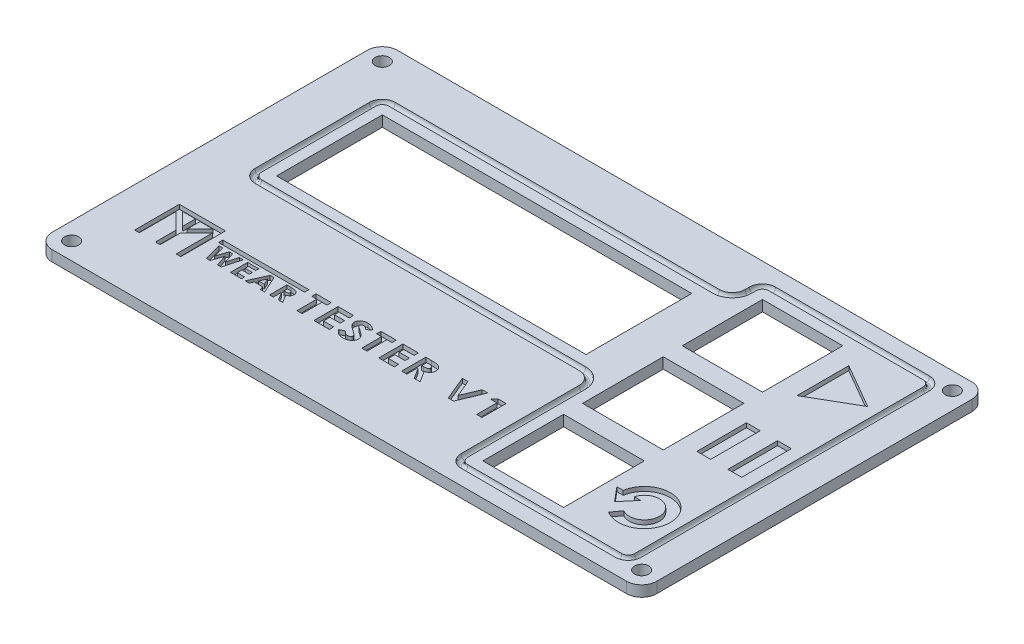
from build123d import *

# Parameters (mm, degrees)
SKETCH1_W           = 140.1
SKETCH1_H           = 80
SKETCH1_R           = 1.65
SKETCH1_W_2         = 71.7
SKETCH1_H_2         = 24.5
SKETCH1_W_3         = 18.6
SKETCH1_H_3         = 18.6
SKETCH1_W_4         = 18.7
SKETCH1_H_4         = 18.7
BOSS_EXTRUDE1_DEPTH = 2.5
FILLET1_R           = 3.5
SKETCH2_W           = 3.2
SKETCH2_H           = 11.5
SKETCH2_W_2         = 19.936371481
SKETCH2_H_2         = 1
CUT_EXTRUDE2_DEPTH  = 1
FILLET2_SIZE        = 1
FILLET2_SIZE_2      = 0.6
FILLET3_SIZE        = 0.6
FILLET3_SIZE_2      = 1


with BuildPart() as part:
    # Sketch1 → Boss-Extrude1 (new body)
    with BuildSketch(Plane(origin=(0, 0, 0), x_dir=(1, 0, 0), z_dir=(0, 1, 0))):
        Rectangle(SKETCH1_W, SKETCH1_H)
        with Locations(Location((-66.05, 36, 0), (0, 0, 270))):
            Circle(SKETCH1_R, mode=Mode.SUBTRACT)
        with Locations(Location((-66.05, -36, 0), (0, 0, 270))):
            Circle(SKETCH1_R, mode=Mode.SUBTRACT)
        with Locations(Location((66.05, -36, 0), (0, 0, 270))):
            Circle(SKETCH1_R, mode=Mode.SUBTRACT)
        with Locations(Location((66.05, 36, 0), (0, 0, 270))):
            Circle(SKETCH1_R, mode=Mode.SUBTRACT)
        with Locations((-19.5, 13.05)):
            Rectangle(SKETCH1_W_2, SKETCH1_H_2, mode=Mode.SUBTRACT)
        with Locations((35.05, 23)):
            Rectangle(SKETCH1_W_3, SKETCH1_H_3, mode=Mode.SUBTRACT)
        with Locations((35.1, -0.05)):
            Rectangle(SKETCH1_W_4, SKETCH1_H_4, mode=Mode.SUBTRACT)
        with Locations((35.1, -23.15)):
            Rectangle(SKETCH1_W_4, SKETCH1_H_4, mode=Mode.SUBTRACT)
    extrude(amount=BOSS_EXTRUDE1_DEPTH)

    # Fillet1
    fillet1_edges = [part.edges().sort_by_distance(p)[0] for p in [
        (-70.05, 1.25, 40),
        (-70.05, 1.25, -40),
        (70.05, 1.25, -40),
        (70.05, 1.25, 40),
    ]]
    fillet(fillet1_edges, radius=FILLET1_R)

    # Sketch2 → Cut-Extrude2 (cut)
    # profile 1 of 19: a face of its own
    with BuildSketch(Plane(origin=(0, 2.5, 0), x_dir=(1, 0, 0), z_dir=(0, 1, 0))):
        Polygon((-50.240034191, -26.517723152), (-51.318411587, -26.517723152), (-51.318411587, -18.049182696), (-55.044160754, -21.760714839), (-55.044160754, -26.517723152), (-56.124160754, -26.517723152), (-56.124160754, -21.760714839), (-59.849909921, -18.049182696), (-59.849909921, -26.517723152), (-60.928287316, -26.517723152), (-60.928287316, -16.167723152), (-50.240034191, -16.167723152), align=None)
        Polygon((-56.124160754, -17.247723152), (-56.124160754, -20.236275502), (-59.124160754, -17.247723152), align=None, mode=Mode.SUBTRACT)
        Polygon((-52.044160754, -17.247723152), (-55.044160754, -17.247723152), (-55.044160754, -20.236275502), align=None, mode=Mode.SUBTRACT)
    # profile 2 of 19: a face of its own
    with BuildSketch(Plane(origin=(0, 2.5, 0), x_dir=(1, 0, 0), z_dir=(0, 1, 0))):
        with BuildLine():
            Line((-59.35, -0.2), (-59.35, 26.3))
            ThreePointArc((-59.35, 26.3), (-58.471320344, 28.421320344), (-56.35, 29.3))
            Line((-56.35, 29.3), (18.75, 29.3))
            ThreePointArc((18.75, 29.3), (20.871320344, 30.178679656), (21.75, 32.3))
            Line((21.75, 32.3), (21.75, 33.3))
            ThreePointArc((21.75, 33.3), (22.628679656, 35.421320344), (24.75, 36.3))
            Line((24.75, 36.3), (60.435027532, 36.3))
            ThreePointArc((60.435027532, 36.3), (62.556347876, 35.421320344), (63.435027532, 33.3))
            Line((63.435027532, 33.3), (63.435027532, -33.5))
            ThreePointArc((63.435027532, -33.5), (62.556347876, -35.621320344), (60.435027532, -36.5))
            Line((60.435027532, -36.5), (24.75, -36.5))
            ThreePointArc((24.75, -36.5), (22.628679656, -35.621320344), (21.75, -33.5))
            Line((21.75, -33.5), (21.75, -6.2))
            ThreePointArc((21.75, -6.2), (20.871320344, -4.078679656), (18.75, -3.2))
            Line((18.75, -3.2), (-56.35, -3.2))
            ThreePointArc((-56.35, -3.2), (-58.471320344, -2.321320344), (-59.35, -0.2))
        make_face()
        with BuildLine():
            Line((-57.85, -0.2), (-57.85, 26.3))
            ThreePointArc((-57.85, 26.3), (-57.410660172, 27.360660172), (-56.35, 27.8))
            Line((-56.35, 27.8), (18.75, 27.8))
            ThreePointArc((18.75, 27.8), (21.931980515, 29.118019485), (23.25, 32.3))
            Line((23.25, 32.3), (23.25, 33.3))
            ThreePointArc((23.25, 33.3), (23.689339828, 34.360660172), (24.75, 34.8))
            Line((24.75, 34.8), (60.435027532, 34.8))
            ThreePointArc((60.435027532, 34.8), (61.495687704, 34.360660172), (61.935027532, 33.3))
            Line((61.935027532, 33.3), (61.935027532, -33.5))
            ThreePointArc((61.935027532, -33.5), (61.495687704, -34.560660172), (60.435027532, -35))
            Line((60.435027532, -35), (24.75, -35))
            ThreePointArc((24.75, -35), (23.689339828, -34.560660172), (23.25, -33.5))
            Line((23.25, -33.5), (23.25, -6.2))
            ThreePointArc((23.25, -6.2), (21.931980515, -3.018019485), (18.75, -1.7))
            Line((18.75, -1.7), (-56.35, -1.7))
            ThreePointArc((-56.35, -1.7), (-57.410660172, -1.260660172), (-57.85, -0.2))
        make_face(mode=Mode.SUBTRACT)
    # profile 3 of 19: a face of its own
    with BuildSketch(Plane(origin=(0, 2.5, 0), x_dir=(1, 0, 0), z_dir=(0, 1, 0))):
        Polygon((49.042722687, 17), (59.435027532, 23), (49.042722687, 29), align=None)
    # profile 4 of 19: a face of its own
    with BuildSketch(Plane(origin=(0, 2.5, 0), x_dir=(1, 0, 0), z_dir=(0, 1, 0))):
        with Locations((57.43602259, -0.05)):
            Rectangle(SKETCH2_W, SKETCH2_H)
    # profile 5 of 19: a face of its own
    with BuildSketch(Plane(origin=(0, 2.5, 0), x_dir=(1, 0, 0), z_dir=(0, 1, 0))):
        with Locations((50.23602259, -0.05)):
            Rectangle(SKETCH2_W, SKETCH2_H)
    # profile 6 of 19: a face of its own
    with BuildSketch(Plane(origin=(0, 2.5, 0), x_dir=(1, 0, 0), z_dir=(0, 1, 0))):
        with BuildLine():
            ThreePointArc((52.084986216, -26.180490326), (57.088225295, -21.856486349), (50.481920624, -22.15))
            Line((50.481920624, -22.15), (51.950931715, -22.15))
            Line((51.950931715, -22.15), (49.200931715, -25.42732238))
            Line((49.200931715, -25.42732238), (46.450931715, -22.15))
            Line((46.450931715, -22.15), (47.919942807, -22.15))
            ThreePointArc((47.919942807, -22.15), (59.320223003, -20.716166433), (50.608376185, -28.207894689))
            Line((50.608376185, -28.207894689), (52.084986216, -26.180490326))
        make_face()
    # profile 7 of 19: a face of its own
    with BuildSketch(Plane(origin=(0, 2.5, 0), x_dir=(1, 0, 0), z_dir=(0, 1, 0))):
        Polygon((14.285191156, -19.233333333), (15.025575772, -18.3), (16.941601413, -18.3), (16.941601413, -23.9), (15.721088592, -23.9), (15.721088592, -19.233333333), align=None)
    # profile 8 of 19: a face of its own
    with BuildSketch(Plane(origin=(0, 2.5, 0), x_dir=(1, 0, 0), z_dir=(0, 1, 0))):
        Polygon((9.123588592, -23.9), (6.796986028, -18.3), (8.087050131, -18.3), (9.740575772, -22.277884615), (11.394101413, -18.3), (12.684165515, -18.3), (10.356441156, -23.9), align=None)
    # profile 9 of 19: a face of its own
    with BuildSketch(Plane(origin=(0, 2.5, 0), x_dir=(1, 0, 0), z_dir=(0, 1, 0))):
        with BuildLine():
            add(Edge.make_bspline(
                [(2.266729618, -19.890705128), (2.267144332, -19.977390659), (2.258340694, -20.10544927), (2.225158053, -20.27053108), (2.189709002, -20.386590015), (2.146746563, -20.49790918), (2.09189184, -20.603117988), (2.028337351, -20.70283251), (1.954292015, -20.796718222), (1.871659061, -20.885691497), (1.777194818, -20.967511669), (1.674387919, -21.045409858), (1.559883011, -21.115687884), (1.436752447, -21.181828691), (1.25482109, -21.265056215), (1.109430364, -21.314458371), (1.009197567, -21.344551282)],
                knots=[0, 0, 0, 0, 0.124685843, 0.18396903, 0.241824688, 0.299056927, 0.3553488, 0.412195564, 0.46889965, 0.527121683, 0.586575429, 0.64843074, 0.712457877, 0.779597179, 0.84939634, 1, 1, 1, 1], degree=3))
            Line((1.009197567, -21.344551282), (2.589806541, -23.9))
            Line((2.589806541, -23.9), (1.213364233, -23.9))
            Line((1.213364233, -23.9), (-0.296571664, -21.458974359))
            Line((-0.296571664, -21.458974359), (-0.46147551, -21.458974359))
            Line((-0.46147551, -21.458974359), (-0.46147551, -23.9))
            Line((-0.46147551, -23.9), (-1.681988331, -23.9))
            Line((-1.681988331, -23.9), (-1.681988331, -18.3))
            Line((-1.681988331, -18.3), (-0.340321664, -18.3))
            add(Edge.make_bspline(
                [(-0.340321664, -18.3), (-0.169749492, -18.299198568), (0.076449583, -18.30449338), (0.391329799, -18.320776826), (0.597904391, -18.338396725), (0.784255643, -18.361796489), (0.950825187, -18.389718018), (1.098056552, -18.421110225), (1.227559269, -18.460181554), (1.344133513, -18.504511973), (1.452575611, -18.555670423), (1.555722508, -18.612291044), (1.652643902, -18.676780442), (1.743812263, -18.747591569), (1.829292245, -18.825247788), (1.90915758, -18.909632872), (1.982945412, -19.000416268), (2.05021207, -19.095872103), (2.107914461, -19.197131658), (2.156990963, -19.302180588), (2.198159354, -19.411463339), (2.227743995, -19.52559247), (2.258560394, -19.684731823), (2.266729855, -19.807823008), (2.266729618, -19.890705128)],
                knots=[0, 0, 0, 0, 0.147269181, 0.212586271, 0.272219192, 0.326243378, 0.374705614, 0.418026054, 0.456126503, 0.491384828, 0.52561704, 0.559580208, 0.592892562, 0.626024487, 0.659167423, 0.692512619, 0.726247885, 0.760104993, 0.79322433, 0.826734811, 0.860140914, 0.89389626, 0.928407503, 1, 1, 1, 1], degree=3))
        make_face()
        with BuildLine():
            add(Edge.make_bspline(
                [(1.046216797, -19.87724359), (1.04775643, -19.81869546), (1.031982403, -19.732399747), (0.983202001, -19.626849), (0.930775933, -19.556962856), (0.86767476, -19.49336031), (0.7931635, -19.439727123), (0.709009563, -19.395508715), (0.630840981, -19.367363918), (0.5593481, -19.349827002), (0.494965121, -19.337658388), (0.420009145, -19.327968024), (0.335513434, -19.318882865), (0.240470903, -19.312322001), (0.093507814, -19.306191139), (-0.02211035, -19.305877661), (-0.102501151, -19.305128205)],
                knots=[0, 0, 0, 0, 0.121157123, 0.179568666, 0.240197836, 0.301751564, 0.365180649, 0.430194707, 0.498789664, 0.537245038, 0.583128135, 0.634900267, 0.694296343, 0.759750269, 0.832876305, 1, 1, 1, 1], degree=3))
            Line((-0.102501151, -19.305128205), (-0.46147551, -19.305128205))
            Line((-0.46147551, -19.305128205), (-0.46147551, -20.453846154))
            Line((-0.46147551, -20.453846154), (-0.050898587, -20.453846154))
            add(Edge.make_bspline(
                [(-0.050898587, -20.453846154), (0.04517916, -20.452545133), (0.183932255, -20.451962897), (0.359948434, -20.436012399), (0.474031244, -20.421275801), (0.576031, -20.404793419), (0.665286522, -20.380380753), (0.743156176, -20.354483217), (0.809480202, -20.322755521), (0.865855873, -20.285946658), (0.914721254, -20.244551063), (0.955314561, -20.196464221), (0.989894663, -20.143847785), (1.013769982, -20.08397456), (1.040803248, -19.996363165), (1.046492365, -19.925297103), (1.046216797, -19.87724359)],
                knots=[0, 0, 0, 0, 0.204850554, 0.295232061, 0.376364878, 0.449978777, 0.515105679, 0.573310074, 0.624622973, 0.671249972, 0.716445993, 0.760518514, 0.804942502, 0.849927358, 0.897317291, 1, 1, 1, 1], degree=3))
        make_face(mode=Mode.SUBTRACT)
    # profile 10 of 19: a face of its own
    with BuildSketch(Plane(origin=(0, 2.5, 0), x_dir=(1, 0, 0), z_dir=(0, 1, 0))):
        Polygon((-6.980449869, -23.9), (-6.980449869, -18.3), (-3.390706279, -18.3), (-3.390706279, -19.305128205), (-5.759937049, -19.305128205), (-5.759937049, -20.382051282), (-3.390706279, -20.382051282), (-3.390706279, -21.387179487), (-5.759937049, -21.387179487), (-5.759937049, -22.894871795), (-3.390706279, -22.894871795), (-3.390706279, -23.9), align=None)
    # profile 11 of 19: a face of its own
    with BuildSketch(Plane(origin=(0, 2.5, 0), x_dir=(1, 0, 0), z_dir=(0, 1, 0))):
        Polygon((-12.063526792, -19.305128205), (-12.063526792, -18.3), (-8.545578074, -18.3), (-8.545578074, -19.305128205), (-9.694296023, -19.305128205), (-9.694296023, -23.9), (-10.914808844, -23.9), (-10.914808844, -19.305128205), align=None)
    # profile 12 of 19: a face of its own
    with BuildSketch(Plane(origin=(0, 2.5, 0), x_dir=(1, 0, 0), z_dir=(0, 1, 0))):
        with BuildLine():
            add(Edge.make_bspline(
                [(-15.18346269, -18.156410256), (-15.021264712, -18.156696864), (-14.77902978, -18.1803204), (-14.465844465, -18.260213372), (-14.276042312, -18.330871228), (-14.125279306, -18.400685874), (-14.009584224, -18.463783948), (-13.89201863, -18.537547421), (-13.770314969, -18.61859778), (-13.648718712, -18.712662758), (-13.477814334, -18.852560962), (-13.352165983, -18.966726984), (-13.269680638, -19.048237179)],
                knots=[0, 0, 0, 0, 0.224009204, 0.33438332, 0.445685447, 0.503228736, 0.563788081, 0.627576777, 0.694912236, 0.765680889, 0.839822751, 1, 1, 1, 1], degree=3))
            Line((-13.269680638, -19.048237179), (-14.208622946, -19.735897436))
            add(Edge.make_bspline(
                [(-14.208622946, -19.735897436), (-14.28521643, -19.64656079), (-14.404349645, -19.522902548), (-14.577951076, -19.385967713), (-14.703945426, -19.304365653), (-14.830477802, -19.240457496), (-14.998563549, -19.180537752), (-15.12958021, -19.16148255), (-15.215994741, -19.161538462)],
                knots=[0, 0, 0, 0, 0.295303603, 0.428877079, 0.553739135, 0.671167669, 0.783579981, 1, 1, 1, 1], degree=3))
            add(Edge.make_bspline(
                [(-15.215994741, -19.161538462), (-15.292080893, -19.161300011), (-15.403752676, -19.1723057), (-15.538925272, -19.222286654), (-15.623811895, -19.271119197), (-15.692462899, -19.328469556), (-15.760522048, -19.407725305), (-15.781876581, -19.481196624), (-15.782501151, -19.528365385)],
                knots=[0, 0, 0, 0, 0.308988589, 0.447952035, 0.580944808, 0.70349073, 0.808979184, 1, 1, 1, 1], degree=3))
            add(Edge.make_bspline(
                [(-15.782501151, -19.528365385), (-15.784213379, -19.576259806), (-15.758431899, -19.673891345), (-15.704671734, -19.758950388), (-15.668078074, -19.796474359)],
                knots=[0, 0, 0, 0, 0.475944074, 1, 1, 1, 1], degree=3))
            add(Edge.make_bspline(
                [(-15.668078074, -19.796474359), (-15.632338804, -19.83572635), (-15.562869687, -19.894982782), (-15.457543968, -19.982200478), (-15.349162231, -20.065885237), (-15.222695638, -20.162892508), (-15.013245214, -20.314423124), (-14.848226659, -20.436718093), (-14.729135767, -20.518910256)],
                knots=[0, 0, 0, 0, 0.133977227, 0.230759984, 0.346009525, 0.480349956, 0.633995626, 1, 1, 1, 1], degree=3))
            add(Edge.make_bspline(
                [(-14.729135767, -20.518910256), (-14.619520432, -20.596760196), (-14.46222691, -20.70516031), (-14.267270859, -20.846161794), (-14.145847118, -20.93100108), (-14.044975245, -21.007446548), (-13.943717562, -21.081872045), (-13.878181811, -21.133993449), (-13.840674228, -21.165064103)],
                knots=[0, 0, 0, 0, 0.367088787, 0.521492782, 0.656907828, 0.771457166, 0.867016653, 1, 1, 1, 1], degree=3))
            add(Edge.make_bspline(
                [(-13.840674228, -21.165064103), (-13.722853561, -21.264876195), (-13.561168924, -21.416164971), (-13.38466809, -21.634769316), (-13.28693275, -21.789356731), (-13.21548261, -21.946432267), (-13.143889861, -22.16277035), (-13.126840143, -22.334715791), (-13.126090895, -22.449519231)],
                knots=[0, 0, 0, 0, 0.304366804, 0.434332212, 0.552441623, 0.663491149, 0.773416579, 1, 1, 1, 1], degree=3))
            add(Edge.make_bspline(
                [(-13.126090895, -22.449519231), (-13.127182424, -22.560338293), (-13.141053443, -22.726120624), (-13.202883659, -22.935098033), (-13.263309388, -23.083449405), (-13.344395477, -23.222621556), (-13.440622934, -23.355988322), (-13.556945606, -23.479827575), (-13.68834541, -23.595606938), (-13.834074509, -23.700837492), (-13.991620656, -23.793343173), (-14.160237335, -23.870372616), (-14.339312219, -23.933771608), (-14.5289709, -23.982520315), (-14.802111841, -24.031800748), (-15.014493884, -24.043740467), (-15.158783203, -24.043589744)],
                knots=[0, 0, 0, 0, 0.115370381, 0.171176354, 0.225851727, 0.281350033, 0.338062346, 0.396328134, 0.45742003, 0.519729533, 0.58274682, 0.646875847, 0.711984232, 0.779812749, 0.850056995, 1, 1, 1, 1], degree=3))
            add(Edge.make_bspline(
                [(-15.158783203, -24.043589744), (-15.273026102, -24.043587144), (-15.442098494, -24.035271477), (-15.662530734, -24.005035473), (-15.819911957, -23.973695959), (-15.971669608, -23.933263746), (-16.117624423, -23.884203515), (-16.257547864, -23.825147518), (-16.392620748, -23.758252436), (-16.522061772, -23.680118991), (-16.646826978, -23.592787592), (-16.765978333, -23.494411207), (-16.881063452, -23.386496458), (-16.990291591, -23.267237375), (-17.134256595, -23.09346693), (-17.230264176, -22.950771992), (-17.290193459, -22.851121795)],
                knots=[0, 0, 0, 0, 0.133395033, 0.197301531, 0.25963615, 0.320636965, 0.38055795, 0.43926413, 0.497840285, 0.556393655, 0.615625126, 0.675496782, 0.736652083, 0.799680074, 0.864190716, 1, 1, 1, 1], degree=3))
            Line((-17.290193459, -22.851121795), (-16.224488331, -22.320512821))
            add(Edge.make_bspline(
                [(-16.224488331, -22.320512821), (-16.150646032, -22.432325361), (-16.029977842, -22.585461915), (-15.8480737, -22.758199416), (-15.711491534, -22.860779645), (-15.56947795, -22.939776038), (-15.374844941, -23.016120955), (-15.219999677, -23.038394357), (-15.117276792, -23.038461538)],
                knots=[0, 0, 0, 0, 0.292060695, 0.42295247, 0.545866055, 0.663349338, 0.776115142, 1, 1, 1, 1], degree=3))
            add(Edge.make_bspline(
                [(-15.117276792, -23.038461538), (-15.015866586, -23.039028908), (-14.867602944, -23.020508185), (-14.685089164, -22.953000813), (-14.569378912, -22.882427848), (-14.471567816, -22.801543336), (-14.377716632, -22.683360403), (-14.345024, -22.577556504), (-14.346603715, -22.507852564)],
                knots=[0, 0, 0, 0, 0.2954704, 0.430684796, 0.564139584, 0.688618973, 0.798927781, 1, 1, 1, 1], degree=3))
            add(Edge.make_bspline(
                [(-14.346603715, -22.507852564), (-14.345007698, -22.441588145), (-14.372006412, -22.341359242), (-14.441610817, -22.216847756), (-14.503640899, -22.138131483), (-14.567038648, -22.072001539), (-14.629115094, -22.015458784), (-14.702966271, -21.951140192), (-14.790991284, -21.882239685), (-14.890831142, -21.805952254), (-15.047797295, -21.689274146), (-15.175120222, -21.603118884), (-15.263110126, -21.541987179)],
                knots=[0, 0, 0, 0, 0.142845548, 0.221998529, 0.309697071, 0.360419396, 0.421544443, 0.492611602, 0.573810517, 0.665086112, 0.766465276, 1, 1, 1, 1], degree=3))
            add(Edge.make_bspline(
                [(-15.263110126, -21.541987179), (-15.431607509, -21.427057665), (-15.671918732, -21.259010396), (-15.971641243, -21.035524271), (-16.161259618, -20.885445045), (-16.326507713, -20.746158375), (-16.46868981, -20.618956783), (-16.585745314, -20.501504654), (-16.680811629, -20.392531286), (-16.756934902, -20.287993281), (-16.823157383, -20.186690949), (-16.877827056, -20.084766492), (-16.92320657, -19.982795461), (-16.959616562, -19.881406361), (-16.991766234, -19.746540664), (-17.004545894, -19.644568228), (-17.003013972, -19.576602564)],
                knots=[0, 0, 0, 0, 0.224706294, 0.32299845, 0.411847771, 0.491072557, 0.561070729, 0.621952114, 0.673650235, 0.720202811, 0.764310708, 0.806887658, 0.847460379, 0.88719842, 0.925365868, 1, 1, 1, 1], degree=3))
            add(Edge.make_bspline(
                [(-17.003013972, -19.576602564), (-17.003542791, -19.48193338), (-16.987727335, -19.340324338), (-16.931526742, -19.160452522), (-16.873829836, -19.031739225), (-16.800164377, -18.907885091), (-16.708565604, -18.790432191), (-16.60133605, -18.677881848), (-16.479556786, -18.572123211), (-16.345733394, -18.474971245), (-16.202242512, -18.389799063), (-16.05079142, -18.317737047), (-15.892206342, -18.257887737), (-15.725803005, -18.212157899), (-15.489873886, -18.167725204), (-15.307142561, -18.157277807), (-15.18346269, -18.156410256)],
                knots=[0, 0, 0, 0, 0.110921546, 0.165526908, 0.220249932, 0.275858717, 0.333966338, 0.394404589, 0.457760192, 0.522706535, 0.587934591, 0.653003504, 0.719006979, 0.786299609, 0.854964891, 1, 1, 1, 1], degree=3))
        make_face()
    # profile 13 of 19: a face of its own
    with BuildSketch(Plane(origin=(0, 2.5, 0), x_dir=(1, 0, 0), z_dir=(0, 1, 0))):
        Polygon((-22.014296023, -23.9), (-22.014296023, -18.3), (-18.424552433, -18.3), (-18.424552433, -19.305128205), (-20.793783203, -19.305128205), (-20.793783203, -20.382051282), (-18.424552433, -20.382051282), (-18.424552433, -21.387179487), (-20.793783203, -21.387179487), (-20.793783203, -22.894871795), (-18.424552433, -22.894871795), (-18.424552433, -23.9), align=None)
    # profile 14 of 19: a face of its own
    with BuildSketch(Plane(origin=(0, 2.5, 0), x_dir=(1, 0, 0), z_dir=(0, 1, 0))):
        Polygon((-27.097372946, -19.305128205), (-27.097372946, -18.3), (-23.579424228, -18.3), (-23.579424228, -19.305128205), (-24.728142177, -19.305128205), (-24.728142177, -23.9), (-25.948654997, -23.9), (-25.948654997, -19.305128205), align=None)
    # profile 15 of 19: a face of its own
    with BuildSketch(Plane(origin=(0, 2.5, 0), x_dir=(1, 0, 0), z_dir=(0, 1, 0))):
        with BuildLine():
            add(Edge.make_bspline(
                [(-29.463431339, -21.036217949), (-29.463135115, -21.098136185), (-29.469423427, -21.189606621), (-29.493125314, -21.3075222), (-29.518446065, -21.390421439), (-29.549133521, -21.469935128), (-29.588315466, -21.545084277), (-29.633711529, -21.616308936), (-29.686601056, -21.683370158), (-29.745624594, -21.746922498), (-29.813099053, -21.805365478), (-29.886532552, -21.861007041), (-29.968321772, -21.911205631), (-30.056272175, -21.958449065), (-30.186223145, -22.017897297), (-30.290073663, -22.05318455), (-30.361668518, -22.074679487)],
                knots=[0, 0, 0, 0, 0.124685843, 0.18396903, 0.241824688, 0.299056927, 0.3553488, 0.412195564, 0.46889965, 0.527121683, 0.586575429, 0.64843074, 0.712457877, 0.779597179, 0.84939634, 1, 1, 1, 1], degree=3))
            Line((-30.361668518, -22.074679487), (-29.232662108, -23.9))
            Line((-29.232662108, -23.9), (-30.215835185, -23.9))
            Line((-30.215835185, -23.9), (-31.294360826, -22.156410256))
            Line((-31.294360826, -22.156410256), (-31.412149288, -22.156410256))
            Line((-31.412149288, -22.156410256), (-31.412149288, -23.9))
            Line((-31.412149288, -23.9), (-32.283944159, -23.9))
            Line((-32.283944159, -23.9), (-32.283944159, -19.9))
            Line((-32.283944159, -19.9), (-31.325610826, -19.9))
            add(Edge.make_bspline(
                [(-31.325610826, -19.9), (-31.20377356, -19.899427549), (-31.027917078, -19.903209557), (-30.803002638, -19.91484059), (-30.655449358, -19.927426232), (-30.522341321, -19.94414035), (-30.403363075, -19.964084299), (-30.298197814, -19.986507303), (-30.205695874, -20.014415396), (-30.122428557, -20.046079981), (-30.044969915, -20.082621731), (-29.97129356, -20.123065032), (-29.902063993, -20.169128887), (-29.836943735, -20.219708264), (-29.775886605, -20.275176992), (-29.718839937, -20.335452052), (-29.666134343, -20.400297335), (-29.61808673, -20.468480073), (-29.576870736, -20.540808327), (-29.541816092, -20.615843277), (-29.512410099, -20.693902385), (-29.491278212, -20.775423193), (-29.469266499, -20.889094159), (-29.46343117, -20.977016435), (-29.463431339, -21.036217949)],
                knots=[0, 0, 0, 0, 0.147269181, 0.212586271, 0.272219192, 0.326243378, 0.374705614, 0.418026054, 0.456126503, 0.491384828, 0.52561704, 0.559580208, 0.592892562, 0.626024487, 0.659167423, 0.692512619, 0.726247885, 0.760104993, 0.79322433, 0.826734811, 0.860140914, 0.89389626, 0.928407503, 1, 1, 1, 1], degree=3))
        make_face()
        with BuildLine():
            add(Edge.make_bspline(
                [(-30.335226211, -21.026602564), (-30.334126474, -20.984782472), (-30.345393635, -20.923142676), (-30.38023678, -20.847749286), (-30.417683971, -20.797830611), (-30.462756238, -20.752400221), (-30.515978566, -20.714090802), (-30.576088521, -20.682506225), (-30.631923223, -20.662402798), (-30.682989566, -20.64987643), (-30.728977408, -20.641184563), (-30.782517391, -20.634262875), (-30.84287147, -20.627773475), (-30.910758992, -20.623087143), (-31.015732628, -20.618707957), (-31.09831703, -20.618484043), (-31.155739031, -20.617948718)],
                knots=[0, 0, 0, 0, 0.121157123, 0.179568666, 0.240197836, 0.301751564, 0.365180649, 0.430194707, 0.498789664, 0.537245038, 0.583128135, 0.634900267, 0.694296343, 0.759750269, 0.832876305, 1, 1, 1, 1], degree=3))
            Line((-31.155739031, -20.617948718), (-31.412149288, -20.617948718))
            Line((-31.412149288, -20.617948718), (-31.412149288, -21.438461538))
            Line((-31.412149288, -21.438461538), (-31.118880057, -21.438461538))
            add(Edge.make_bspline(
                [(-31.118880057, -21.438461538), (-31.050253095, -21.437532238), (-30.951143741, -21.437116355), (-30.825417899, -21.425723142), (-30.743930178, -21.415197001), (-30.671073209, -21.403423871), (-30.607319265, -21.385986252), (-30.551698083, -21.367488012), (-30.504323779, -21.344825372), (-30.464055443, -21.318533327), (-30.429151599, -21.288965045), (-30.40015638, -21.2546173), (-30.375456307, -21.217034132), (-30.358402508, -21.174267543), (-30.339093032, -21.111687975), (-30.335029377, -21.060926502), (-30.335226211, -21.026602564)],
                knots=[0, 0, 0, 0, 0.204850554, 0.295232061, 0.376364878, 0.449978777, 0.515105679, 0.573310074, 0.624622973, 0.671249972, 0.716445993, 0.760518514, 0.804942502, 0.849927358, 0.897317291, 1, 1, 1, 1], degree=3))
        make_face(mode=Mode.SUBTRACT)
    # profile 16 of 19: a face of its own
    with BuildSketch(Plane(origin=(0, 2.5, 0), x_dir=(1, 0, 0), z_dir=(0, 1, 0))):
        Polygon((-41.340354416, -23.9), (-41.340354416, -19.9), (-38.776251852, -19.9), (-38.776251852, -20.617948718), (-40.468559544, -20.617948718), (-40.468559544, -21.387179487), (-38.776251852, -21.387179487), (-38.776251852, -22.105128205), (-40.468559544, -22.105128205), (-40.468559544, -23.182051282), (-38.776251852, -23.182051282), (-38.776251852, -23.9), align=None)
    # profile 17 of 19: a face of its own
    with BuildSketch(Plane(origin=(0, 2.5, 0), x_dir=(1, 0, 0), z_dir=(0, 1, 0))):
        Polygon((-37.940354416, -23.9), (-36.131860826, -19.9), (-35.237630057, -19.9), (-33.427533903, -23.9), (-34.359424929, -23.9), (-34.72320698, -23.079487179), (-36.643880057, -23.079487179), (-37.007662108, -23.9), align=None)
        Polygon((-35.041315954, -22.361538462), (-35.683944159, -20.972916667), (-36.326572365, -22.361538462), align=None, mode=Mode.SUBTRACT)
    # profile 18 of 19: a face of its own
    with BuildSketch(Plane(origin=(0, 2.5, 0), x_dir=(1, 0, 0), z_dir=(0, 1, 0))):
        with Locations((-38.733707137, -18.8)):
            Rectangle(SKETCH2_W_2, SKETCH2_H_2)
    # profile 19 of 19: a face of its own
    with BuildSketch(Plane(origin=(0, 2.5, 0), x_dir=(1, 0, 0), z_dir=(0, 1, 0))):
        Polygon((-46.935867236, -23.9), (-48.022405698, -19.9), (-47.125771083, -19.9), (-46.432662108, -22.453685897), (-45.579296724, -19.9), (-44.821283903, -19.9), (-43.971123647, -22.453685897), (-43.279617236, -19.9), (-42.381380057, -19.9), (-43.465514672, -23.9), (-44.340514672, -23.9), (-45.201892877, -21.314262821), (-46.065674929, -23.9), align=None)
    extrude(amount=-CUT_EXTRUDE2_DEPTH, mode=Mode.SUBTRACT)

    # Fillet2
    # an asymmetric fillet: 1, 0.6 mm, written as the material it adds along each edge
    with BuildSketch(Plane(origin=(60.435027532, 1.5, 36.5), x_dir=(0, 1, 0), z_dir=(-1, 0, 0)), Plane(origin=(24.75, 1.5, -36.3), x_dir=(0, 1, 0), z_dir=(1, 0, 0))) as fillet2_piece_1:
        with BuildLine():
            Bezier((FILLET2_SIZE, 0), (0, 0), (0, FILLET2_SIZE_2), weights=[1, 0.707106781, 1])
            Line((0, FILLET2_SIZE_2), (0, 0))
            Line((0, 0), (FILLET2_SIZE, 0))
        make_face()
    extrude(amount=35.685027532)
    with BuildSketch(Plane(origin=(24.75, 1.5, 33.5), x_dir=(0, 0, 1), z_dir=(1, 0, 0))) as fillet2_piece_2:
        with BuildLine():
            Bezier((3, -FILLET2_SIZE), (3, 0), (3 - FILLET2_SIZE_2, 0), weights=[1, 0.707106781, 1])
            Line((3 - FILLET2_SIZE_2, 0), (3, 0))
            Line((3, 0), (3, -FILLET2_SIZE))
        make_face()
    revolve(axis=Axis((24.75, 1.5, 33.5), (0, -1, 0)), revolution_arc=90)
    with BuildSketch(Plane(origin=(60.435027532, 1.5, 33.5), x_dir=(1, 0, 0), z_dir=(0, 0, -1))) as fillet2_piece_3:
        with BuildLine():
            Bezier((3, -FILLET2_SIZE), (3, 0), (3 - FILLET2_SIZE_2, 0), weights=[1, 0.707106781, 1])
            Line((3 - FILLET2_SIZE_2, 0), (3, 0))
            Line((3, 0), (3, -FILLET2_SIZE))
        make_face()
    revolve(axis=Axis((60.435027532, 1.5, 33.5), (0, -1, 0)), revolution_arc=90)
    with BuildSketch(Plane(origin=(21.75, 1.5, 33.5), x_dir=(0, 1, 0), z_dir=(0, 0, -1))) as fillet2_piece_4:
        with BuildLine():
            Bezier((FILLET2_SIZE, 0), (0, 0), (0, FILLET2_SIZE_2), weights=[1, 0.707106781, 1])
            Line((0, FILLET2_SIZE_2), (0, 0))
            Line((0, 0), (FILLET2_SIZE, 0))
        make_face()
    extrude(amount=27.3)
    with BuildSketch(Plane(origin=(63.435027532, 1.5, -33.3), x_dir=(0, 1, 0), z_dir=(0, 0, 1))) as fillet2_piece_5:
        with BuildLine():
            Bezier((FILLET2_SIZE, 0), (0, 0), (0, FILLET2_SIZE_2), weights=[1, 0.707106781, 1])
            Line((0, FILLET2_SIZE_2), (0, 0))
            Line((0, 0), (FILLET2_SIZE, 0))
        make_face()
    extrude(amount=66.8)
    with BuildSketch(Plane(origin=(18.75, 1.5, 6.2), x_dir=(1, 0, 0), z_dir=(0, 0, 1))) as fillet2_piece_6:
        with BuildLine():
            Bezier((3, FILLET2_SIZE), (3, 0), (3 + FILLET2_SIZE_2, 0), weights=[1, 0.707106781, 1])
            Line((3 + FILLET2_SIZE_2, 0), (3, 0))
            Line((3, 0), (3, FILLET2_SIZE))
        make_face()
    revolve(axis=Axis((18.75, 1.5, 6.2), (0, 1, 0)), revolution_arc=90)
    with BuildSketch(Plane(origin=(60.435027532, 1.5, -33.3), x_dir=(0, 0, -1), z_dir=(-1, 0, 0))) as fillet2_piece_7:
        with BuildLine():
            Bezier((3, -FILLET2_SIZE), (3, 0), (3 - FILLET2_SIZE_2, 0), weights=[1, 0.707106781, 1])
            Line((3 - FILLET2_SIZE_2, 0), (3, 0))
            Line((3, 0), (3, -FILLET2_SIZE))
        make_face()
    revolve(axis=Axis((60.435027532, 1.5, -33.3), (0, -1, 0)), revolution_arc=90)
    with BuildSketch(Plane(origin=(18.75, 1.5, 3.2), x_dir=(0, 1, 0), z_dir=(-1, 0, 0)), Plane(origin=(-56.35, 1.5, -29.3), x_dir=(0, 1, 0), z_dir=(1, 0, 0))) as fillet2_piece_8:
        with BuildLine():
            Bezier((FILLET2_SIZE, 0), (0, 0), (0, FILLET2_SIZE_2), weights=[1, 0.707106781, 1])
            Line((0, FILLET2_SIZE_2), (0, 0))
            Line((0, 0), (FILLET2_SIZE, 0))
        make_face()
    extrude(amount=75.1)
    with BuildSketch(Plane(origin=(-56.35, 1.5, 0.2), x_dir=(0, 0, 1), z_dir=(1, 0, 0))) as fillet2_piece_9:
        with BuildLine():
            Bezier((3, -FILLET2_SIZE), (3, 0), (3 - FILLET2_SIZE_2, 0), weights=[1, 0.707106781, 1])
            Line((3 - FILLET2_SIZE_2, 0), (3, 0))
            Line((3, 0), (3, -FILLET2_SIZE))
        make_face()
    revolve(axis=Axis((-56.35, 1.5, 0.2), (0, -1, 0)), revolution_arc=90)
    with BuildSketch(Plane(origin=(24.75, 1.5, -33.3), x_dir=(-1, 0, 0), z_dir=(0, 0, 1))) as fillet2_piece_10:
        with BuildLine():
            Bezier((3, -FILLET2_SIZE), (3, 0), (3 - FILLET2_SIZE_2, 0), weights=[1, 0.707106781, 1])
            Line((3 - FILLET2_SIZE_2, 0), (3, 0))
            Line((3, 0), (3, -FILLET2_SIZE))
        make_face()
    revolve(axis=Axis((24.75, 1.5, -33.3), (0, -1, 0)), revolution_arc=90)
    with BuildSketch(Plane(origin=(-59.35, 1.5, 0.2), x_dir=(0, 1, 0), z_dir=(0, 0, -1))) as fillet2_piece_11:
        with BuildLine():
            Bezier((FILLET2_SIZE, 0), (0, 0), (0, FILLET2_SIZE_2), weights=[1, 0.707106781, 1])
            Line((0, FILLET2_SIZE_2), (0, 0))
            Line((0, 0), (FILLET2_SIZE, 0))
        make_face()
    extrude(amount=26.5)
    with BuildSketch(Plane(origin=(21.75, 1.5, -32.3), x_dir=(0, 1, 0), z_dir=(0, 0, -1))) as fillet2_piece_12:
        with BuildLine():
            Bezier((FILLET2_SIZE, 0), (0, 0), (0, FILLET2_SIZE_2), weights=[1, 0.707106781, 1])
            Line((0, FILLET2_SIZE_2), (0, 0))
            Line((0, 0), (FILLET2_SIZE, 0))
        make_face()
    extrude(amount=1)
    with BuildSketch(Plane(origin=(-56.35, 1.5, -26.3), x_dir=(-1, 0, 0), z_dir=(0, 0, 1))) as fillet2_piece_13:
        with BuildLine():
            Bezier((3, -FILLET2_SIZE), (3, 0), (3 - FILLET2_SIZE_2, 0), weights=[1, 0.707106781, 1])
            Line((3 - FILLET2_SIZE_2, 0), (3, 0))
            Line((3, 0), (3, -FILLET2_SIZE))
        make_face()
    revolve(axis=Axis((-56.35, 1.5, -26.3), (0, -1, 0)), revolution_arc=90)
    with BuildSketch(Plane(origin=(18.75, 1.5, -32.3), x_dir=(0, 0, 1), z_dir=(-1, 0, 0))) as fillet2_piece_14:
        with BuildLine():
            Bezier((3, FILLET2_SIZE), (3, 0), (3 + FILLET2_SIZE_2, 0), weights=[1, 0.707106781, 1])
            Line((3 + FILLET2_SIZE_2, 0), (3, 0))
            Line((3, 0), (3, FILLET2_SIZE))
        make_face()
    revolve(axis=Axis((18.75, 1.5, -32.3), (0, 1, 0)), revolution_arc=90)

    # Fillet3
    # an asymmetric fillet: 1, 0.6 mm, written as the material it adds along each edge
    with BuildSketch(Plane(origin=(60.435027532, 1.5, 35), x_dir=(0, 0, 1), z_dir=(-1, 0, 0)), Plane(origin=(24.75, 1.5, -34.8), x_dir=(0, 0, -1), z_dir=(1, 0, 0))) as fillet3_piece_1:
        with BuildLine():
            Bezier((FILLET3_SIZE, 0), (0, 0), (0, FILLET3_SIZE_2), weights=[1, 0.707106781, 1])
            Line((0, FILLET3_SIZE_2), (0, 0))
            Line((0, 0), (FILLET3_SIZE, 0))
        make_face()
    extrude(amount=35.685027532)
    with BuildSketch(Plane(origin=(24.75, 1.5, 33.5), x_dir=(0, 0, 1), z_dir=(1, 0, 0))) as fillet3_piece_2:
        with BuildLine():
            Bezier((1.5 + FILLET3_SIZE, 0), (1.5, 0), (1.5, -FILLET3_SIZE_2), weights=[1, 0.707106781, 1])
            Line((1.5, -FILLET3_SIZE_2), (1.5, 0))
            Line((1.5, 0), (1.5 + FILLET3_SIZE, 0))
        make_face()
    revolve(axis=Axis((24.75, 1.5, 33.5), (0, -1, 0)), revolution_arc=90)
    with BuildSketch(Plane(origin=(60.435027532, 1.5, 33.5), x_dir=(1, 0, 0), z_dir=(0, 0, -1))) as fillet3_piece_3:
        with BuildLine():
            Bezier((1.5 + FILLET3_SIZE, 0), (1.5, 0), (1.5, -FILLET3_SIZE_2), weights=[1, 0.707106781, 1])
            Line((1.5, -FILLET3_SIZE_2), (1.5, 0))
            Line((1.5, 0), (1.5 + FILLET3_SIZE, 0))
        make_face()
    revolve(axis=Axis((60.435027532, 1.5, 33.5), (0, -1, 0)), revolution_arc=90)
    with BuildSketch(Plane(origin=(23.25, 1.5, 33.5), x_dir=(-1, 0, 0), z_dir=(0, 0, -1))) as fillet3_piece_4:
        with BuildLine():
            Bezier((FILLET3_SIZE, 0), (0, 0), (0, FILLET3_SIZE_2), weights=[1, 0.707106781, 1])
            Line((0, FILLET3_SIZE_2), (0, 0))
            Line((0, 0), (FILLET3_SIZE, 0))
        make_face()
    extrude(amount=27.3)
    with BuildSketch(Plane(origin=(61.935027532, 1.5, -33.3), x_dir=(1, 0, 0), z_dir=(0, 0, 1))) as fillet3_piece_5:
        with BuildLine():
            Bezier((FILLET3_SIZE, 0), (0, 0), (0, FILLET3_SIZE_2), weights=[1, 0.707106781, 1])
            Line((0, FILLET3_SIZE_2), (0, 0))
            Line((0, 0), (FILLET3_SIZE, 0))
        make_face()
    extrude(amount=66.8)
    with BuildSketch(Plane(origin=(18.75, 1.5, 6.2), x_dir=(1, 0, 0), z_dir=(0, 0, 1))) as fillet3_piece_6:
        with BuildLine():
            Bezier((4.5 - FILLET3_SIZE, 0), (4.5, 0), (4.5, FILLET3_SIZE_2), weights=[1, 0.707106781, 1])
            Line((4.5, FILLET3_SIZE_2), (4.5, 0))
            Line((4.5, 0), (4.5 - FILLET3_SIZE, 0))
        make_face()
    revolve(axis=Axis((18.75, 1.5, 6.2), (0, 1, 0)), revolution_arc=90)
    with BuildSketch(Plane(origin=(60.435027532, 1.5, -33.3), x_dir=(0, 0, -1), z_dir=(-1, 0, 0))) as fillet3_piece_7:
        with BuildLine():
            Bezier((1.5 + FILLET3_SIZE, 0), (1.5, 0), (1.5, -FILLET3_SIZE_2), weights=[1, 0.707106781, 1])
            Line((1.5, -FILLET3_SIZE_2), (1.5, 0))
            Line((1.5, 0), (1.5 + FILLET3_SIZE, 0))
        make_face()
    revolve(axis=Axis((60.435027532, 1.5, -33.3), (0, -1, 0)), revolution_arc=90)
    with BuildSketch(Plane(origin=(18.75, 1.5, 1.7), x_dir=(0, 0, 1), z_dir=(-1, 0, 0)), Plane(origin=(-56.35, 1.5, -27.8), x_dir=(0, 0, -1), z_dir=(1, 0, 0))) as fillet3_piece_8:
        with BuildLine():
            Bezier((FILLET3_SIZE, 0), (0, 0), (0, FILLET3_SIZE_2), weights=[1, 0.707106781, 1])
            Line((0, FILLET3_SIZE_2), (0, 0))
            Line((0, 0), (FILLET3_SIZE, 0))
        make_face()
    extrude(amount=75.1)
    with BuildSketch(Plane(origin=(-56.35, 1.5, 0.2), x_dir=(0, 0, 1), z_dir=(1, 0, 0))) as fillet3_piece_9:
        with BuildLine():
            Bezier((1.5 + FILLET3_SIZE, 0), (1.5, 0), (1.5, -FILLET3_SIZE_2), weights=[1, 0.707106781, 1])
            Line((1.5, -FILLET3_SIZE_2), (1.5, 0))
            Line((1.5, 0), (1.5 + FILLET3_SIZE, 0))
        make_face()
    revolve(axis=Axis((-56.35, 1.5, 0.2), (0, -1, 0)), revolution_arc=90)
    with BuildSketch(Plane(origin=(24.75, 1.5, -33.3), x_dir=(-1, 0, 0), z_dir=(0, 0, 1))) as fillet3_piece_10:
        with BuildLine():
            Bezier((1.5 + FILLET3_SIZE, 0), (1.5, 0), (1.5, -FILLET3_SIZE_2), weights=[1, 0.707106781, 1])
            Line((1.5, -FILLET3_SIZE_2), (1.5, 0))
            Line((1.5, 0), (1.5 + FILLET3_SIZE, 0))
        make_face()
    revolve(axis=Axis((24.75, 1.5, -33.3), (0, -1, 0)), revolution_arc=90)
    with BuildSketch(Plane(origin=(-57.85, 1.5, 0.2), x_dir=(-1, 0, 0), z_dir=(0, 0, -1))) as fillet3_piece_11:
        with BuildLine():
            Bezier((FILLET3_SIZE, 0), (0, 0), (0, FILLET3_SIZE_2), weights=[1, 0.707106781, 1])
            Line((0, FILLET3_SIZE_2), (0, 0))
            Line((0, 0), (FILLET3_SIZE, 0))
        make_face()
    extrude(amount=26.5)
    with BuildSketch(Plane(origin=(23.25, 1.5, -32.3), x_dir=(-1, 0, 0), z_dir=(0, 0, -1))) as fillet3_piece_12:
        with BuildLine():
            Bezier((FILLET3_SIZE, 0), (0, 0), (0, FILLET3_SIZE_2), weights=[1, 0.707106781, 1])
            Line((0, FILLET3_SIZE_2), (0, 0))
            Line((0, 0), (FILLET3_SIZE, 0))
        make_face()
    extrude(amount=1)
    with BuildSketch(Plane(origin=(-56.35, 1.5, -26.3), x_dir=(-1, 0, 0), z_dir=(0, 0, 1))) as fillet3_piece_13:
        with BuildLine():
            Bezier((1.5 + FILLET3_SIZE, 0), (1.5, 0), (1.5, -FILLET3_SIZE_2), weights=[1, 0.707106781, 1])
            Line((1.5, -FILLET3_SIZE_2), (1.5, 0))
            Line((1.5, 0), (1.5 + FILLET3_SIZE, 0))
        make_face()
    revolve(axis=Axis((-56.35, 1.5, -26.3), (0, -1, 0)), revolution_arc=90)
    with BuildSketch(Plane(origin=(18.75, 1.5, -32.3), x_dir=(0, 0, 1), z_dir=(-1, 0, 0))) as fillet3_piece_14:
        with BuildLine():
            Bezier((4.5 - FILLET3_SIZE, 0), (4.5, 0), (4.5, FILLET3_SIZE_2), weights=[1, 0.707106781, 1])
            Line((4.5, FILLET3_SIZE_2), (4.5, 0))
            Line((4.5, 0), (4.5 - FILLET3_SIZE, 0))
        make_face()
    revolve(axis=Axis((18.75, 1.5, -32.3), (0, 1, 0)), revolution_arc=90)


solid = part.part
